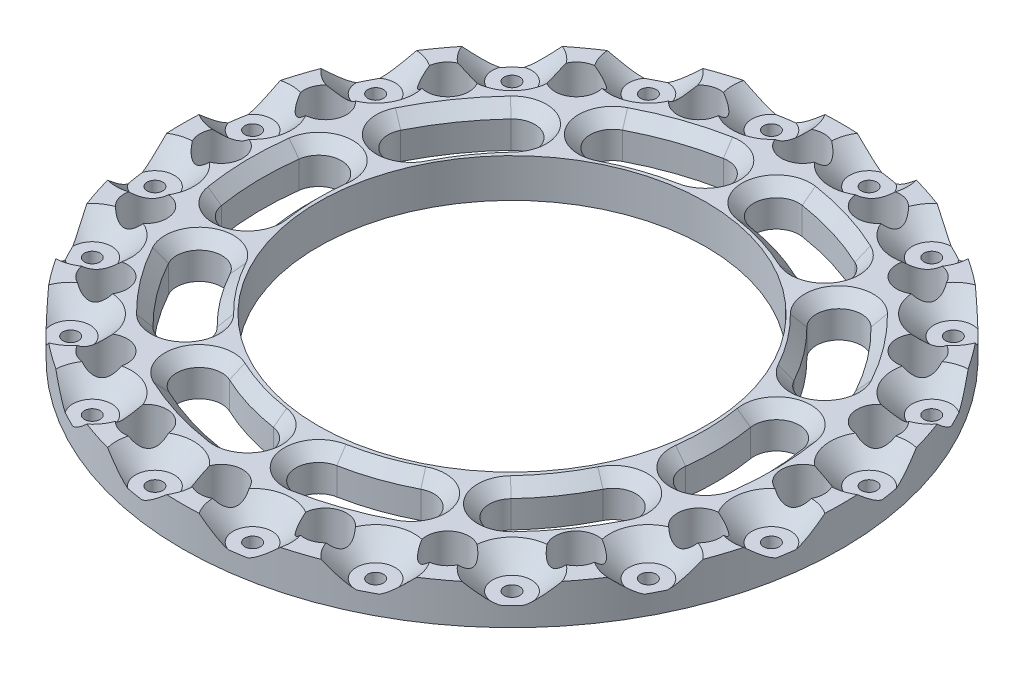
from build123d import *

# Parameters (mm, degrees)
SKETCH1_R           = 85
SKETCH1_R_2         = 5.5
SKETCH1_R_3         = 50
BOSS_EXTRUDE4_DEPTH = 10
SKETCH4_R           = 2
CUT_EXTRUDE5_DEPTH  = 15
SKETCH5_R           = 5
CUT_EXTRUDE6_DEPTH  = 5
CHAMFER4_SIZE       = 5
CUT_EXTRUDE7_DEPTH  = 15
CHAMFER5_SIZE       = 3


with BuildPart() as part:
    # Sketch1 → Boss-Extrude4 (new body)
    with BuildSketch(Plane(origin=(0, 0, 0), x_dir=(1, 0, 0), z_dir=(0, 1, 0))):
        with Locations(Location((0, 0, 0), (0, 0, 270))):
            Circle(SKETCH1_R)
        with Locations(Location((-75, 0, 0), (0, 0, 270))):
            Circle(SKETCH1_R_2, mode=Mode.SUBTRACT)
        with Locations(Location((-71.329238722, 23.176274578, 0), (0, 0, 270))):
            Circle(SKETCH1_R_2, mode=Mode.SUBTRACT)
        with Locations(Location((-60.676274578, 44.083893922, 0), (0, 0, 270))):
            Circle(SKETCH1_R_2, mode=Mode.SUBTRACT)
        with Locations(Location((-44.083893922, 60.676274578, 0), (0, 0, 270))):
            Circle(SKETCH1_R_2, mode=Mode.SUBTRACT)
        with Locations(Location((-23.176274578, 71.329238722, 0), (0, 0, 270))):
            Circle(SKETCH1_R_2, mode=Mode.SUBTRACT)
        with Locations(Location((0, 75, 0), (0, 0, 270))):
            Circle(SKETCH1_R_2, mode=Mode.SUBTRACT)
        with Locations(Location((23.176274578, 71.329238722, 0), (0, 0, 270))):
            Circle(SKETCH1_R_2, mode=Mode.SUBTRACT)
        with Locations(Location((44.083893922, 60.676274578, 0), (0, 0, 270))):
            Circle(SKETCH1_R_2, mode=Mode.SUBTRACT)
        with Locations(Location((60.676274578, 44.083893922, 0), (0, 0, 270))):
            Circle(SKETCH1_R_2, mode=Mode.SUBTRACT)
        with Locations(Location((71.329238722, 23.176274578, 0), (0, 0, 270))):
            Circle(SKETCH1_R_2, mode=Mode.SUBTRACT)
        with Locations(Location((75, 0, 0), (0, 0, 270))):
            Circle(SKETCH1_R_2, mode=Mode.SUBTRACT)
        with Locations(Location((71.329238722, -23.176274578, 0), (0, 0, 270))):
            Circle(SKETCH1_R_2, mode=Mode.SUBTRACT)
        with Locations(Location((60.676274578, -44.083893922, 0), (0, 0, 270))):
            Circle(SKETCH1_R_2, mode=Mode.SUBTRACT)
        with Locations(Location((44.083893922, -60.676274578, 0), (0, 0, 270))):
            Circle(SKETCH1_R_2, mode=Mode.SUBTRACT)
        with Locations(Location((23.176274578, -71.329238722, 0), (0, 0, 270))):
            Circle(SKETCH1_R_2, mode=Mode.SUBTRACT)
        with Locations(Location((0, -75, 0), (0, 0, 270))):
            Circle(SKETCH1_R_2, mode=Mode.SUBTRACT)
        with Locations(Location((-23.176274578, -71.329238722, 0), (0, 0, 270))):
            Circle(SKETCH1_R_2, mode=Mode.SUBTRACT)
        with Locations(Location((-44.083893922, -60.676274578, 0), (0, 0, 270))):
            Circle(SKETCH1_R_2, mode=Mode.SUBTRACT)
        with Locations(Location((-60.676274578, -44.083893922, 0), (0, 0, 270))):
            Circle(SKETCH1_R_2, mode=Mode.SUBTRACT)
        with Locations(Location((-71.329238722, -23.176274578, 0), (0, 0, 270))):
            Circle(SKETCH1_R_2, mode=Mode.SUBTRACT)
        with Locations(Location((0, 0, 0), (0, 0, 270))):
            Circle(SKETCH1_R_3, mode=Mode.SUBTRACT)
    extrude(amount=BOSS_EXTRUDE4_DEPTH)

    # Sketch4 → Cut-Extrude5 (cut)
    with BuildSketch(Plane(origin=(0, 10, 0), x_dir=(1, 0, 0), z_dir=(0, 1, 0))):
        with Locations(Location((-79.508911418, 12.592974436, 0), (0, 0, 270))):
            Circle(SKETCH4_R)
        with Locations(Location((-71.726025197, 36.546235229, 0), (0, 0, 270))):
            Circle(SKETCH4_R)
        with Locations(Location((-56.922095886, 56.922095886, 0), (0, 0, 270))):
            Circle(SKETCH4_R)
        with Locations(Location((-36.546235229, 71.726025197, 0), (0, 0, 270))):
            Circle(SKETCH4_R)
        with Locations(Location((-12.592974436, 79.508911418, 0), (0, 0, 270))):
            Circle(SKETCH4_R)
        with Locations(Location((12.592974436, 79.508911418, 0), (0, 0, 270))):
            Circle(SKETCH4_R)
        with Locations(Location((36.546235229, 71.726025197, 0), (0, 0, 270))):
            Circle(SKETCH4_R)
        with Locations(Location((56.922095886, 56.922095886, 0), (0, 0, 270))):
            Circle(SKETCH4_R)
        with Locations(Location((71.726025197, 36.546235229, 0), (0, 0, 270))):
            Circle(SKETCH4_R)
        with Locations(Location((79.508911418, 12.592974436, 0), (0, 0, 270))):
            Circle(SKETCH4_R)
        with Locations(Location((79.508911418, -12.592974436, 0), (0, 0, 270))):
            Circle(SKETCH4_R)
        with Locations(Location((71.726025197, -36.546235229, 0), (0, 0, 270))):
            Circle(SKETCH4_R)
        with Locations(Location((56.922095886, -56.922095886, 0), (0, 0, 270))):
            Circle(SKETCH4_R)
        with Locations(Location((36.546235229, -71.726025197, 0), (0, 0, 270))):
            Circle(SKETCH4_R)
        with Locations(Location((12.592974436, -79.508911418, 0), (0, 0, 270))):
            Circle(SKETCH4_R)
        with Locations(Location((-12.592974436, -79.508911418, 0), (0, 0, 270))):
            Circle(SKETCH4_R)
        with Locations(Location((-36.546235229, -71.726025197, 0), (0, 0, 270))):
            Circle(SKETCH4_R)
        with Locations(Location((-56.922095886, -56.922095886, 0), (0, 0, 270))):
            Circle(SKETCH4_R)
        with Locations(Location((-71.726025197, -36.546235229, 0), (0, 0, 270))):
            Circle(SKETCH4_R)
        with Locations(Location((-79.508911418, -12.592974436, 0), (0, 0, 270))):
            Circle(SKETCH4_R)
    extrude(amount=-CUT_EXTRUDE5_DEPTH, mode=Mode.SUBTRACT)

    # Sketch5 → Cut-Extrude6 (cut)
    with BuildSketch(Plane(origin=(0, 10, 0), x_dir=(1, 0, 0), z_dir=(0, 1, 0))):
        with Locations((-71.726025197, -36.546235229)):
            Circle(SKETCH5_R)
        with Locations((-79.508911418, -12.592974436)):
            Circle(SKETCH5_R)
        with Locations((-79.508911418, 12.592974436)):
            Circle(SKETCH5_R)
        with Locations((-71.726025197, 36.546235229)):
            Circle(SKETCH5_R)
        with Locations((-56.922095886, 56.922095886)):
            Circle(SKETCH5_R)
        with Locations((-36.546235229, 71.726025197)):
            Circle(SKETCH5_R)
        with Locations((-12.592974436, 79.508911418)):
            Circle(SKETCH5_R)
        with Locations((12.592974436, 79.508911418)):
            Circle(SKETCH5_R)
        with Locations((36.546235229, 71.726025197)):
            Circle(SKETCH5_R)
        with Locations((56.922095886, 56.922095886)):
            Circle(SKETCH5_R)
        with Locations((71.726025197, 36.546235229)):
            Circle(SKETCH5_R)
        with Locations((79.508911418, 12.592974436)):
            Circle(SKETCH5_R)
        with Locations((79.508911418, -12.592974436)):
            Circle(SKETCH5_R)
        with Locations((71.726025197, -36.546235229)):
            Circle(SKETCH5_R)
        with Locations((56.922095886, -56.922095886)):
            Circle(SKETCH5_R)
        with Locations((36.546235229, -71.726025197)):
            Circle(SKETCH5_R)
        with Locations((12.592974436, -79.508911418)):
            Circle(SKETCH5_R)
        with Locations((-12.592974436, -79.508911418)):
            Circle(SKETCH5_R)
        with Locations((-36.546235229, -71.726025197)):
            Circle(SKETCH5_R)
        with Locations((-56.922095886, -56.922095886)):
            Circle(SKETCH5_R)
    extrude(amount=-CUT_EXTRUDE6_DEPTH, mode=Mode.SUBTRACT)

    # Chamfer4
    # the kernel refuses this chamfer: 5 mm, written as the material it takes off along each edge
    with BuildSketch(Plane(origin=(-36.546235229, 10, -71.726025197), x_dir=(-0.4511890844417182, 0, -0.892428378123782), z_dir=(-0.892428378123782, 0, 0.4511890844417182))) as chamfer4_piece_1_section:
        Polygon((5, CHAMFER4_SIZE), (5 + CHAMFER4_SIZE, 0), (5, 0), align=None)
    chamfer4_piece_1 = revolve(axis=Axis((-36.546235229, 10, -71.726025197), (0, -1, 0)), revolution_arc=359.64, mode=Mode.PRIVATE)
    chamfer4_piece_1 = split(chamfer4_piece_1, bisect_by=Plane(origin=(-33.13587383, 5, -65.032814088), z_dir=(0, 1, 0)), keep=Keep.TOP, mode=Mode.PRIVATE)
    add(chamfer4_piece_1, mode=Mode.SUBTRACT)
    with BuildSketch(Plane(origin=(-12.592974436, 10, -79.508911418), x_dir=(-0.153330783736591, 0, -0.9881749191103377), z_dir=(-0.9881749191103377, 0, 0.153330783736591))) as chamfer4_piece_2_section:
        Polygon((5, CHAMFER4_SIZE), (5 + CHAMFER4_SIZE, 0), (5, 0), align=None)
    chamfer4_piece_2 = revolve(axis=Axis((-12.592974436, 10, -79.508911418), (0, -1, 0)), revolution_arc=359.64, mode=Mode.PRIVATE)
    chamfer4_piece_2 = split(chamfer4_piece_2, bisect_by=Plane(origin=(-11.417843984, 5, -72.089429747), z_dir=(0, 1, 0)), keep=Keep.TOP, mode=Mode.PRIVATE)
    add(chamfer4_piece_2, mode=Mode.SUBTRACT)
    with BuildSketch(Plane(origin=(12.592974436, 10, -79.508911418), x_dir=(0.15953660239811235, 0, -0.9871920139948795), z_dir=(-0.9871920139948795, 0, -0.15953660239811235))) as chamfer4_piece_3_section:
        Polygon((5, CHAMFER4_SIZE), (5 + CHAMFER4_SIZE, 0), (5, 0), align=None)
    chamfer4_piece_3 = revolve(axis=Axis((12.592974436, 10, -79.508911418), (0, -1, 0)), revolution_arc=359.64, mode=Mode.PRIVATE)
    chamfer4_piece_3 = split(chamfer4_piece_3, bisect_by=Plane(origin=(11.417843984, 5, -72.089429747), z_dir=(0, 1, 0)), keep=Keep.TOP, mode=Mode.PRIVATE)
    add(chamfer4_piece_3, mode=Mode.SUBTRACT)
    with BuildSketch(Plane(origin=(36.546235229, 10, -71.726025197), x_dir=(0.45678743433417224, 0, -0.8895758763784034), z_dir=(-0.8895758763784034, 0, -0.45678743433417224))) as chamfer4_piece_4_section:
        Polygon((5, CHAMFER4_SIZE), (5 + CHAMFER4_SIZE, 0), (5, 0), align=None)
    chamfer4_piece_4 = revolve(axis=Axis((36.546235229, 10, -71.726025197), (0, -1, 0)), revolution_arc=359.64, mode=Mode.PRIVATE)
    chamfer4_piece_4 = split(chamfer4_piece_4, bisect_by=Plane(origin=(33.135873829, 5, -65.032814086), z_dir=(0, 1, 0)), keep=Keep.TOP, mode=Mode.PRIVATE)
    add(chamfer4_piece_4, mode=Mode.SUBTRACT)
    with BuildSketch(Plane(origin=(56.922095886, 10, -56.922095886), x_dir=(0.7093247295722704, 0, -0.7048818539423649), z_dir=(-0.7048818539423649, 0, -0.7093247295722704))) as chamfer4_piece_5_section:
        Polygon((5, CHAMFER4_SIZE), (5 + CHAMFER4_SIZE, 0), (5, 0), align=None)
    chamfer4_piece_5 = revolve(axis=Axis((56.922095886, 10, -56.922095886), (0, -1, 0)), revolution_arc=359.64, mode=Mode.PRIVATE)
    chamfer4_piece_5 = split(chamfer4_piece_5, bisect_by=Plane(origin=(51.610333473, 5, -51.610333473), z_dir=(0, 1, 0)), keep=Keep.TOP, mode=Mode.PRIVATE)
    add(chamfer4_piece_5, mode=Mode.SUBTRACT)
    with BuildSketch(Plane(origin=(71.726025197, 10, -36.546235229), x_dir=(0.892428378123782, 0, -0.4511890844417182), z_dir=(-0.4511890844417182, 0, -0.892428378123782))) as chamfer4_piece_6_section:
        Polygon((5, CHAMFER4_SIZE), (5 + CHAMFER4_SIZE, 0), (5, 0), align=None)
    chamfer4_piece_6 = revolve(axis=Axis((71.726025197, 10, -36.546235229), (0, -1, 0)), revolution_arc=359.64, mode=Mode.PRIVATE)
    chamfer4_piece_6 = split(chamfer4_piece_6, bisect_by=Plane(origin=(65.03281409, 5, -33.135873831), z_dir=(0, 1, 0)), keep=Keep.TOP, mode=Mode.PRIVATE)
    add(chamfer4_piece_6, mode=Mode.SUBTRACT)
    with BuildSketch(Plane(origin=(79.508911418, 10, -12.592974436), x_dir=(0.9871920139949479, 0, -0.15953660239769005), z_dir=(0.15953660239769005, 0, 0.9871920139949479))) as chamfer4_piece_7_section:
        Polygon((5, -CHAMFER4_SIZE), (5 + CHAMFER4_SIZE, 0), (5, 0), align=None)
    chamfer4_piece_7 = revolve(axis=Axis((79.508911418, 10, -12.592974436), (0, 1, 0)), revolution_arc=359.64, mode=Mode.PRIVATE)
    chamfer4_piece_7 = split(chamfer4_piece_7, bisect_by=Plane(origin=(72.089429748, 5, -11.417843984), z_dir=(0, 1, 0)), keep=Keep.TOP, mode=Mode.PRIVATE)
    add(chamfer4_piece_7, mode=Mode.SUBTRACT)
    with BuildSketch(Plane(origin=(79.508911418, 10, 12.592974436), x_dir=(0.9881749191104042, 0, 0.15333078373616343), z_dir=(-0.15333078373616343, 0, 0.9881749191104042))) as chamfer4_piece_8_section:
        Polygon((5, -CHAMFER4_SIZE), (5 + CHAMFER4_SIZE, 0), (5, 0), align=None)
    chamfer4_piece_8 = revolve(axis=Axis((79.508911418, 10, 12.592974436), (0, 1, 0)), revolution_arc=359.64, mode=Mode.PRIVATE)
    chamfer4_piece_8 = split(chamfer4_piece_8, bisect_by=Plane(origin=(72.089429751, 5, 11.417843984), z_dir=(0, 1, 0)), keep=Keep.TOP, mode=Mode.PRIVATE)
    add(chamfer4_piece_8, mode=Mode.SUBTRACT)
    with BuildSketch(Plane(origin=(71.726025197, 10, 36.546235229), x_dir=(0.8895758763784045, 0, 0.4567874343341699), z_dir=(0.4567874343341699, 0, -0.8895758763784045))) as chamfer4_piece_9_section:
        Polygon((5, CHAMFER4_SIZE), (5 + CHAMFER4_SIZE, 0), (5, 0), align=None)
    chamfer4_piece_9 = revolve(axis=Axis((71.726025197, 10, 36.546235229), (0, -1, 0)), revolution_arc=359.64, mode=Mode.PRIVATE)
    chamfer4_piece_9 = split(chamfer4_piece_9, bisect_by=Plane(origin=(65.032814088, 5, 33.13587383), z_dir=(0, 1, 0)), keep=Keep.TOP, mode=Mode.PRIVATE)
    add(chamfer4_piece_9, mode=Mode.SUBTRACT)
    with BuildSketch(Plane(origin=(56.922095886, 10, 56.922095886), x_dir=(0.7048818539423591, 0, 0.7093247295722761), z_dir=(0.7093247295722761, 0, -0.7048818539423591))) as chamfer4_piece_10_section:
        Polygon((5, CHAMFER4_SIZE), (5 + CHAMFER4_SIZE, 0), (5, 0), align=None)
    chamfer4_piece_10 = revolve(axis=Axis((56.922095886, 10, 56.922095886), (0, -1, 0)), revolution_arc=359.64, mode=Mode.PRIVATE)
    chamfer4_piece_10 = split(chamfer4_piece_10, bisect_by=Plane(origin=(51.610333475, 5, 51.610333475), z_dir=(0, 1, 0)), keep=Keep.TOP, mode=Mode.PRIVATE)
    add(chamfer4_piece_10, mode=Mode.SUBTRACT)
    with BuildSketch(Plane(origin=(36.546235229, 10, 71.726025197), x_dir=(0.4511890844417091, 0, 0.8924283781237866), z_dir=(0.8924283781237866, 0, -0.4511890844417091))) as chamfer4_piece_11_section:
        Polygon((5, CHAMFER4_SIZE), (5 + CHAMFER4_SIZE, 0), (5, 0), align=None)
    chamfer4_piece_11 = revolve(axis=Axis((36.546235229, 10, 71.726025197), (0, -1, 0)), revolution_arc=359.64, mode=Mode.PRIVATE)
    chamfer4_piece_11 = split(chamfer4_piece_11, bisect_by=Plane(origin=(33.13587383, 5, 65.032814088), z_dir=(0, 1, 0)), keep=Keep.TOP, mode=Mode.PRIVATE)
    add(chamfer4_piece_11, mode=Mode.SUBTRACT)
    with BuildSketch(Plane(origin=(12.592974436, 10, 79.508911418), x_dir=(0.15333078373658685, 0, 0.9881749191103385), z_dir=(0.9881749191103385, 0, -0.15333078373658685))) as chamfer4_piece_12_section:
        Polygon((5, CHAMFER4_SIZE), (5 + CHAMFER4_SIZE, 0), (5, 0), align=None)
    chamfer4_piece_12 = revolve(axis=Axis((12.592974436, 10, 79.508911418), (0, -1, 0)), revolution_arc=359.64, mode=Mode.PRIVATE)
    chamfer4_piece_12 = split(chamfer4_piece_12, bisect_by=Plane(origin=(11.417843984, 5, 72.089429748), z_dir=(0, 1, 0)), keep=Keep.TOP, mode=Mode.PRIVATE)
    add(chamfer4_piece_12, mode=Mode.SUBTRACT)
    with BuildSketch(Plane(origin=(-12.592974436, 10, 79.508911418), x_dir=(-0.15953660239806436, 0, 0.9871920139948873), z_dir=(0.9871920139948873, 0, 0.15953660239806436))) as chamfer4_piece_13_section:
        Polygon((5, CHAMFER4_SIZE), (5 + CHAMFER4_SIZE, 0), (5, 0), align=None)
    chamfer4_piece_13 = revolve(axis=Axis((-12.592974436, 10, 79.508911418), (0, -1, 0)), revolution_arc=359.64, mode=Mode.PRIVATE)
    chamfer4_piece_13 = split(chamfer4_piece_13, bisect_by=Plane(origin=(-11.417843984, 5, 72.089429748), z_dir=(0, 1, 0)), keep=Keep.TOP, mode=Mode.PRIVATE)
    add(chamfer4_piece_13, mode=Mode.SUBTRACT)
    with BuildSketch(Plane(origin=(-36.546235229, 10, 71.726025197), x_dir=(-0.4567874343342016, 0, 0.8895758763783882), z_dir=(0.8895758763783882, 0, 0.4567874343342016))) as chamfer4_piece_14_section:
        Polygon((5, CHAMFER4_SIZE), (5 + CHAMFER4_SIZE, 0), (5, 0), align=None)
    chamfer4_piece_14 = revolve(axis=Axis((-36.546235229, 10, 71.726025197), (0, -1, 0)), revolution_arc=359.64, mode=Mode.PRIVATE)
    chamfer4_piece_14 = split(chamfer4_piece_14, bisect_by=Plane(origin=(-33.13587383, 5, 65.032814088), z_dir=(0, 1, 0)), keep=Keep.TOP, mode=Mode.PRIVATE)
    add(chamfer4_piece_14, mode=Mode.SUBTRACT)
    with BuildSketch(Plane(origin=(-56.922095886, 10, 56.922095886), x_dir=(-0.7093247295722847, 0, 0.7048818539423507), z_dir=(0.7048818539423507, 0, 0.7093247295722847))) as chamfer4_piece_15_section:
        Polygon((5, CHAMFER4_SIZE), (5 + CHAMFER4_SIZE, 0), (5, 0), align=None)
    chamfer4_piece_15 = revolve(axis=Axis((-56.922095886, 10, 56.922095886), (0, -1, 0)), revolution_arc=359.64, mode=Mode.PRIVATE)
    chamfer4_piece_15 = split(chamfer4_piece_15, bisect_by=Plane(origin=(-51.610333474, 5, 51.610333474), z_dir=(0, 1, 0)), keep=Keep.TOP, mode=Mode.PRIVATE)
    add(chamfer4_piece_15, mode=Mode.SUBTRACT)
    with BuildSketch(Plane(origin=(-71.726025197, 10, 36.546235229), x_dir=(-0.8924283781237711, 0, 0.4511890844417397), z_dir=(0.4511890844417397, 0, 0.8924283781237711))) as chamfer4_piece_16_section:
        Polygon((5, CHAMFER4_SIZE), (5 + CHAMFER4_SIZE, 0), (5, 0), align=None)
    chamfer4_piece_16 = revolve(axis=Axis((-71.726025197, 10, 36.546235229), (0, -1, 0)), revolution_arc=359.64, mode=Mode.PRIVATE)
    chamfer4_piece_16 = split(chamfer4_piece_16, bisect_by=Plane(origin=(-65.032814088, 5, 33.13587383), z_dir=(0, 1, 0)), keep=Keep.TOP, mode=Mode.PRIVATE)
    add(chamfer4_piece_16, mode=Mode.SUBTRACT)
    with BuildSketch(Plane(origin=(-79.508911418, 10, 12.592974436), x_dir=(-0.9881749191103971, 0, 0.15333078373620831), z_dir=(0.15333078373620831, 0, 0.9881749191103971))) as chamfer4_piece_17_section:
        Polygon((5, CHAMFER4_SIZE), (5 + CHAMFER4_SIZE, 0), (5, 0), align=None)
    chamfer4_piece_17 = revolve(axis=Axis((-79.508911418, 10, 12.592974436), (0, -1, 0)), revolution_arc=359.64, mode=Mode.PRIVATE)
    chamfer4_piece_17 = split(chamfer4_piece_17, bisect_by=Plane(origin=(-72.089429748, 5, 11.417843984), z_dir=(0, 1, 0)), keep=Keep.TOP, mode=Mode.PRIVATE)
    add(chamfer4_piece_17, mode=Mode.SUBTRACT)
    with BuildSketch(Plane(origin=(-56.922095886, 10, -56.922095886), x_dir=(-0.704881853942367, 0, -0.7093247295722683), z_dir=(-0.7093247295722683, 0, 0.704881853942367))) as chamfer4_piece_18_section:
        Polygon((5, CHAMFER4_SIZE), (5 + CHAMFER4_SIZE, 0), (5, 0), align=None)
    chamfer4_piece_18 = revolve(axis=Axis((-56.922095886, 10, -56.922095886), (0, -1, 0)), revolution_arc=359.64, mode=Mode.PRIVATE)
    chamfer4_piece_18 = split(chamfer4_piece_18, bisect_by=Plane(origin=(-51.610333474, 5, -51.610333474), z_dir=(0, 1, 0)), keep=Keep.TOP, mode=Mode.PRIVATE)
    add(chamfer4_piece_18, mode=Mode.SUBTRACT)
    with BuildSketch(Plane(origin=(-71.726025197, 10, -36.546235229), x_dir=(-0.8895758763783986, 0, -0.4567874343341813), z_dir=(-0.4567874343341813, 0, 0.8895758763783986))) as chamfer4_piece_19_section:
        Polygon((5, CHAMFER4_SIZE), (5 + CHAMFER4_SIZE, 0), (5, 0), align=None)
    chamfer4_piece_19 = revolve(axis=Axis((-71.726025197, 10, -36.546235229), (0, -1, 0)), revolution_arc=359.64, mode=Mode.PRIVATE)
    chamfer4_piece_19 = split(chamfer4_piece_19, bisect_by=Plane(origin=(-65.032814088, 5, -33.13587383), z_dir=(0, 1, 0)), keep=Keep.TOP, mode=Mode.PRIVATE)
    add(chamfer4_piece_19, mode=Mode.SUBTRACT)
    with BuildSketch(Plane(origin=(-79.508911418, 10, -12.592974436), x_dir=(-0.9871920139949422, 0, -0.15953660239772452), z_dir=(-0.15953660239772452, 0, 0.9871920139949422))) as chamfer4_piece_20_section:
        Polygon((5, CHAMFER4_SIZE), (5 + CHAMFER4_SIZE, 0), (5, 0), align=None)
    chamfer4_piece_20 = revolve(axis=Axis((-79.508911418, 10, -12.592974436), (0, -1, 0)), revolution_arc=359.64, mode=Mode.PRIVATE)
    chamfer4_piece_20 = split(chamfer4_piece_20, bisect_by=Plane(origin=(-72.089429748, 5, -11.417843984), z_dir=(0, 1, 0)), keep=Keep.TOP, mode=Mode.PRIVATE)
    add(chamfer4_piece_20, mode=Mode.SUBTRACT)

    # Sketch6 → Cut-Extrude7 (cut)
    with BuildSketch(Plane(origin=(0, 10, 0), x_dir=(1, 0, 0), z_dir=(0, 1, 0))):
        with BuildLine():
            Line((-53.894274698, 0), (-65.605538936, 0))
            ThreePointArc((-65.605538936, 0), (-65.32853484, -5.15259177), (-64.67557932, -10.271144525))
            Line((-64.67557932, -10.271144525), (-53.110404544, -8.439400791))
            ThreePointArc((-53.110404544, -8.439400791), (-53.113629593, -8.419265645), (-53.116924754, -8.399141854))
            ThreePointArc((-53.116924754, -8.399141854), (-53.656339763, -4.213522086), (-53.894274698, 0))
        make_face()
        with BuildLine():
            ThreePointArc((-65.050481957, 10.120542917), (-65.510035492, 5.070254547), (-65.605538936, 0))
            Line((-65.605538936, 0), (-53.894274698, 0))
            ThreePointArc((-53.894274698, 0), (-53.828458119, 4.240085671), (-53.457350848, 8.464412565))
            Line((-53.457350848, 8.464412565), (-65.025331999, 10.296600785))
            ThreePointArc((-65.025331999, 10.296600785), (-65.03857553, 10.208667354), (-65.050481957, 10.120542917))
        make_face()
        with BuildLine():
            Line((-65.025331999, 10.296600785), (-53.457350848, 8.464412565))
            ThreePointArc((-53.457350848, 8.464412565), (-53.446310122, 8.55268233), (-53.435135925, 8.640935297))
            ThreePointArc((-53.435135925, 8.640935297), (-58.414880694, 15.176505696), (-65.025331999, 10.296600785))
        make_face()
        with BuildLine():
            Line((-53.110404544, -8.439400791), (-64.67557932, -10.271144525))
            ThreePointArc((-64.67557932, -10.271144525), (-64.672257794, -10.291264286), (-64.668930451, -10.311383085))
            ThreePointArc((-64.668930451, -10.311383085), (-57.956930778, -15.134560479), (-53.110404544, -8.439400791))
        make_face()
        with BuildLine():
            ThreePointArc((-46.678239523, 46.423405161), (-53.138664678, 38.472383405), (-58.379142651, 29.66935945))
            ThreePointArc((-58.379142651, 29.66935945), (-55.765796055, 21.812949923), (-47.909386529, 24.42629652))
            ThreePointArc((-47.909386529, 24.42629652), (-43.53886615, 31.767954244), (-38.150918726, 38.399048354))
            ThreePointArc((-38.150918726, 38.399048354), (-38.402400721, 46.674887156), (-46.678239523, 46.423405161))
        make_face()
        with BuildLine():
            ThreePointArc((-10.476496127, 64.994104507), (-20.376583197, 62.358935413), (-29.790506592, 58.317415099))
            ThreePointArc((-29.790506592, 58.317415099), (-32.294146439, 50.425359689), (-24.40209103, 47.921719842))
            ThreePointArc((-24.40209103, 47.921719842), (-16.550947631, 51.292318285), (-8.294347276, 53.490030075))
            ThreePointArc((-8.294347276, 53.490030075), (-3.633384486, 60.333141716), (-10.476496127, 64.994104507))
        make_face()
        with BuildLine():
            ThreePointArc((29.726912707, 58.739264999), (20.168660491, 62.426493595), (10.177090443, 64.690200316))
            ThreePointArc((10.177090443, 64.690200316), (3.512769478, 59.776995948), (8.425973846, 53.112674984))
            ThreePointArc((8.425973846, 53.112674984), (16.758870337, 51.224760102), (24.730382919, 48.149638366))
            ThreePointArc((24.730382919, 48.149638366), (32.523461129, 50.946186789), (29.726912707, 58.739264999))
        make_face()
        with BuildLine():
            ThreePointArc((58.575651267, 30.048022737), (53.010161378, 38.649253023), (46.257384835, 46.353527752))
            ThreePointArc((46.257384835, 46.353527752), (37.97792685, 46.295851501), (38.035603101, 38.016393516))
            ThreePointArc((38.035603101, 38.016393516), (43.667369449, 31.591084626), (48.308947394, 24.417721348))
            ThreePointArc((48.308947394, 24.417721348), (56.257450025, 22.099520106), (58.575651267, 30.048022737))
        make_face()
        with BuildLine():
            ThreePointArc((65.050481957, -10.120542917), (65.603582369, 0.109311436), (64.668930451, 10.311383085))
            ThreePointArc((64.668930451, 10.311383085), (57.936806987, 15.131265318), (53.116924754, 8.399141854))
            ThreePointArc((53.116924754, 8.399141854), (53.896417631, -0.109311436), (53.435135925, -8.640935297))
            ThreePointArc((53.435135925, -8.640935297), (58.503005131, -15.188412123), (65.050481957, -10.120542917))
        make_face()
        with BuildLine():
            ThreePointArc((46.678239523, -46.423405161), (53.138664678, -38.472383405), (58.379142651, -29.66935945))
            ThreePointArc((58.379142651, -29.66935945), (55.765796055, -21.812949923), (47.909386529, -24.42629652))
            ThreePointArc((47.909386529, -24.42629652), (43.53886615, -31.767954244), (38.150918726, -38.399048354))
            ThreePointArc((38.150918726, -38.399048354), (38.402400721, -46.674887156), (46.678239523, -46.423405161))
        make_face()
        with BuildLine():
            ThreePointArc((10.476496127, -64.994104507), (20.376583197, -62.358935413), (29.790506592, -58.317415099))
            ThreePointArc((29.790506592, -58.317415099), (32.294146439, -50.425359689), (24.40209103, -47.921719842))
            ThreePointArc((24.40209103, -47.921719842), (16.550947631, -51.292318285), (8.294347276, -53.490030075))
            ThreePointArc((8.294347276, -53.490030075), (3.633384486, -60.333141716), (10.476496127, -64.994104507))
        make_face()
        with BuildLine():
            ThreePointArc((-29.726912707, -58.739264999), (-20.168660491, -62.426493595), (-10.177090443, -64.690200316))
            ThreePointArc((-10.177090443, -64.690200316), (-3.512769478, -59.776995948), (-8.425973846, -53.112674984))
            ThreePointArc((-8.425973846, -53.112674984), (-16.758870337, -51.224760102), (-24.730382919, -48.149638366))
            ThreePointArc((-24.730382919, -48.149638366), (-32.523461129, -50.946186789), (-29.726912707, -58.739264999))
        make_face()
        with BuildLine():
            ThreePointArc((-58.575651267, -30.048022737), (-53.010161378, -38.649253023), (-46.257384835, -46.353527752))
            ThreePointArc((-46.257384835, -46.353527752), (-37.97792685, -46.295851501), (-38.035603101, -38.016393516))
            ThreePointArc((-38.035603101, -38.016393516), (-43.667369449, -31.591084626), (-48.308947394, -24.417721348))
            ThreePointArc((-48.308947394, -24.417721348), (-56.257450025, -22.099520106), (-58.575651267, -30.048022737))
        make_face()
    extrude(amount=-CUT_EXTRUDE7_DEPTH, mode=Mode.SUBTRACT)

    # Chamfer5
    chamfer5_edges = [part.edges().sort_by_distance(p)[0] for p in [
        (-43.53886615, 10, -31.767954244),
        (-53.138664678, 10, -38.472383405),
        (-55.765796055, 10, -21.812949923),
        (-38.402400721, 10, -46.674887156),
        (-16.550947631, 10, -51.292318285),
        (-20.376583197, 10, -62.358935413),
        (-32.294146439, 10, -50.425359689),
        (-3.633384486, 10, -60.333141716),
        (16.758870337, 10, -51.224760102),
        (20.168660491, 10, -62.426493595),
        (3.512769478, 10, -59.776995948),
        (32.523461129, 10, -50.946186789),
        (43.667369449, 10, -31.591084626),
        (53.010161378, 10, -38.649253023),
        (37.97792685, 10, -46.295851501),
        (56.257450025, 10, -22.099520106),
        (53.896417631, 10, 0.109311436),
        (65.603582369, 10, -0.109311436),
        (57.936806987, 10, -15.131265318),
        (58.503005131, 10, 15.188412123),
        (43.53886615, 10, 31.767954244),
        (53.138664678, 10, 38.472383405),
        (55.765796055, 10, 21.812949923),
        (38.402400721, 10, 46.674887156),
        (16.550947631, 10, 51.292318285),
        (20.376583197, 10, 62.358935413),
        (32.294146439, 10, 50.425359689),
        (3.633384486, 10, 60.333141716),
        (-16.758870337, 10, 51.224760102),
        (-20.168660491, 10, 62.426493595),
        (-3.512769478, 10, 59.776995948),
        (-32.523461129, 10, 50.946186789),
        (-43.667369449, 10, 31.591084626),
        (-53.010161378, 10, 38.649253023),
        (-37.97792685, 10, 46.295851501),
        (-56.257450025, 10, 22.099520106),
        (-53.896417631, 10, -0.109311436),
        (-65.603582369, 10, 0.109311436),
        (-57.936806987, 10, 15.131265318),
        (-58.503005131, 10, -15.188412123),
    ]]
    chamfer(chamfer5_edges, length=CHAMFER5_SIZE)


solid = part.part
